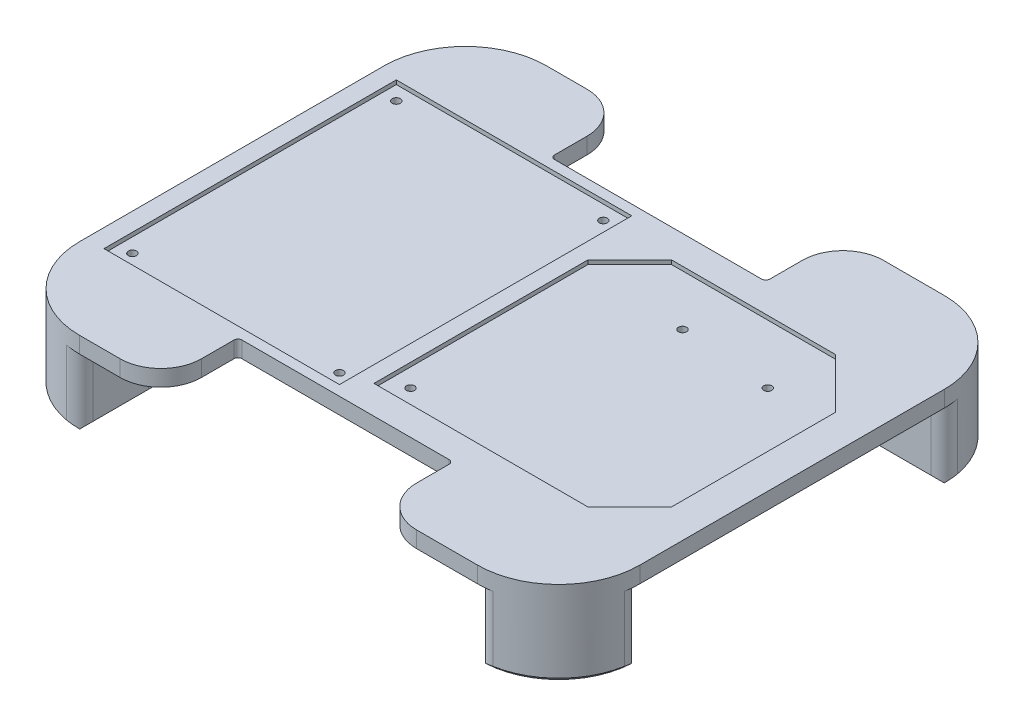
from build123d import *

# Parameters (mm, degrees)
TABLE_DEPTH                  = 4
PIEDS_START                  = 17
PIEDS_DEPTH                  = 17
ENL_V_MAT_EXTRU_3_DEPTH      = 93.240175629
ENL_V_MAT_EXTRU_3_DEPTH_BACK = 93.240175629
ESQUISSE5_W                  = 5
ESQUISSE5_H                  = 18
ENL_V_MAT_EXTRU_4_DEPTH      = 93.240175629
ENL_V_MAT_EXTRU_4_DEPTH_BACK = 93.240175629
ESQUISSE6_W                  = 43
ESQUISSE6_H                  = 18
CONG_1_R                     = 10
CHANFREIN1_SIZE              = 1
CONG_2_R                     = 3
ESQUISSE3_R                  = 1
ENL_V_MAT_EXTRU_5_DEPTH      = 18
ENL_V_MAT_EXTRU_6_DEPTH      = 93.240175629
ENL_V_MAT_EXTRU_6_DEPTH_BACK = 93.240175629
ESQUISSE4_R                  = 1
ESQUISSE8_W                  = 58
ESQUISSE8_H                  = 72
ENL_V_MAT_EXTRU_7_DEPTH      = 1
ENL_V_MAT_EXTRU_8_DEPTH      = 1
ENL_V_MAT_EXTRU_9_DEPTH      = 93.240175629
ENL_V_MAT_EXTRU_9_DEPTH_BACK = 93.240175629
ESQUISSE11_W                 = 53
ESQUISSE11_H                 = 1
CONG_3_R                     = 1
CONG_4_R                     = 3


with BuildPart() as part:
    # Esquisse1 → table (new body)
    with BuildSketch(Plane(origin=(0, 0, 0), x_dir=(1, 0, 0), z_dir=(0, 1, 0))):
        with BuildLine():
            Line((-49, -57.5), (49, -57.5))
            ThreePointArc((49, -57.5), (63.142135624, -51.642135624), (69, -37.5))
            Line((69, -37.5), (69, 37.5))
            ThreePointArc((69, 37.5), (63.142135624, 51.642135624), (49, 57.5))
            Line((49, 57.5), (-49, 57.5))
            ThreePointArc((-49, 57.5), (-63.142135624, 51.642135624), (-69, 37.5))
            Line((-69, 37.5), (-69, -37.5))
            ThreePointArc((-69, -37.5), (-63.142135624, -51.642135624), (-49, -57.5))
        make_face()
    extrude(amount=TABLE_DEPTH)

    # Esquisse2 → pieds (add)
    with BuildSketch(Plane.XZ.offset(PIEDS_START)):
        with BuildLine():
            Line((-49, 57.5), (-49, 37.5))
            Line((-49, 37.5), (-69, 37.5))
            ThreePointArc((-69, 37.5), (-63.142135624, 51.642135624), (-49, 57.5))
        make_face()
        with BuildLine():
            Line((-69, -37.5), (-49, -37.5))
            Line((-49, -37.5), (-49, -57.5))
            ThreePointArc((-49, -57.5), (-63.142135624, -51.642135624), (-69, -37.5))
        make_face()
        with BuildLine():
            Line((49, -57.5), (49, -37.5))
            Line((49, -37.5), (69, -37.5))
            ThreePointArc((69, -37.5), (63.142135624, -51.642135624), (49, -57.5))
        make_face()
        with BuildLine():
            Line((49, 57.5), (49, 37.5))
            Line((49, 37.5), (69, 37.5))
            ThreePointArc((69, 37.5), (63.142135624, 51.642135624), (49, 57.5))
        make_face()
    extrude(amount=-PIEDS_DEPTH)

    # Esquisse5 → Enlèv. mat.-Extru.3 (cut, two sides: drawn at the far end of the back side and taken through both)
    with BuildSketch(Plane(origin=(0, 4, 0), x_dir=(1, 0, 0), z_dir=(0, 1, 0)).offset(-ENL_V_MAT_EXTRU_3_DEPTH_BACK)):
        with Locations((-26.5, 48.5)):
            Rectangle(ESQUISSE5_W, ESQUISSE5_H)
        with Locations((21.5, 48.5)):
            Rectangle(ESQUISSE5_W, ESQUISSE5_H)
        with Locations((-26.5, -48.5)):
            Rectangle(ESQUISSE5_W, ESQUISSE5_H)
        with Locations((21.5, -48.5)):
            Rectangle(ESQUISSE5_W, ESQUISSE5_H)
    extrude(amount=ENL_V_MAT_EXTRU_3_DEPTH + ENL_V_MAT_EXTRU_3_DEPTH_BACK, mode=Mode.SUBTRACT)

    # Esquisse6 → Enlèv. mat.-Extru.4 (cut, two sides: drawn at the far end of the back side and taken through both)
    with BuildSketch(Plane(origin=(0, 4, 0), x_dir=(1, 0, 0), z_dir=(0, 1, 0)).offset(-ENL_V_MAT_EXTRU_4_DEPTH_BACK)):
        with Locations((-2.5, 48.5)):
            Rectangle(ESQUISSE6_W, ESQUISSE6_H)
        with Locations((-2.5, -48.5)):
            Rectangle(ESQUISSE6_W, ESQUISSE6_H)
    extrude(amount=ENL_V_MAT_EXTRU_4_DEPTH + ENL_V_MAT_EXTRU_4_DEPTH_BACK, mode=Mode.SUBTRACT)

    # Congé1
    cong_1_edges = [part.edges().sort_by_distance(p)[0] for p in [
        (24, 2, 57.5),
        (-29, 2, -57.5),
        (24, 2, -57.5),
        (-29, 2, 57.5),
    ]]
    fillet(cong_1_edges, radius=CONG_1_R)

    # Chanfrein1
    chanfrein1_edges = [part.edges().sort_by_distance(p)[0] for p in [
        (59, -17, -37.5),
        (49, -17, -47.5),
        (63.142135624, -17, -51.642135624),
        (-49, -17, -47.5),
        (-59, -17, -37.5),
        (-63.142135624, -17, -51.642135624),
        (-59, -17, 37.5),
        (-49, -17, 47.5),
        (-63.142135624, -17, 51.642135624),
        (59, -17, 37.5),
        (63.142135624, -17, 51.642135624),
        (49, -17, 47.5),
    ]]
    chamfer(chanfrein1_edges, length=CHANFREIN1_SIZE)

    # Congé2
    cong_2_edges = [part.edges().sort_by_distance(p)[0] for p in [
        (49, -8, 37.5),
        (49, -8, -37.5),
        (-49, -8, -37.5),
        (-49, -8, 37.5),
    ]]
    fillet(cong_2_edges, radius=CONG_2_R)

    # Esquisse3 → Enlèv. mat.-Extru.5 (cut)
    with BuildSketch(Plane(origin=(0, 4, 0), x_dir=(1, 0, 0), z_dir=(0, 1, 0))):
        with Locations(Location((-10, -32.5, 0), (0, 0, 270))):
            Circle(ESQUISSE3_R)
        with Locations(Location((-61, -32.5, 0), (0, 0, 270))):
            Circle(ESQUISSE3_R)
        with Locations(Location((-61, 32.5, 0), (0, 0, 270))):
            Circle(ESQUISSE3_R)
        with Locations(Location((-10, 32.5, 0), (0, 0, 270))):
            Circle(ESQUISSE3_R)
    extrude(amount=-ENL_V_MAT_EXTRU_5_DEPTH, mode=Mode.SUBTRACT)

    # Esquisse4 → Enlèv. mat.-Extru.6 (cut, two sides: drawn at the far end of the back side and taken through both)
    with BuildSketch(Plane(origin=(0, 4, 0), x_dir=(1, 0, 0), z_dir=(0, 1, 0)).offset(-ENL_V_MAT_EXTRU_6_DEPTH_BACK)):
        with Locations(Location((2, -27, 0), (0, 0, 270))):
            Circle(ESQUISSE4_R)
        with Locations(Location((46, 17, 0), (0, 0, 270))):
            Circle(ESQUISSE4_R)
        with Locations(Location((23, 19, 0), (0, 0, 270))):
            Circle(ESQUISSE4_R)
    extrude(amount=ENL_V_MAT_EXTRU_6_DEPTH + ENL_V_MAT_EXTRU_6_DEPTH_BACK, mode=Mode.SUBTRACT)

    # Esquisse8 → Enlèv. mat.-Extru.7 (cut)
    with BuildSketch(Plane(origin=(0, 4, 0), x_dir=(1, 0, 0), z_dir=(0, 1, 0))):
        with Locations((-35.5, 0)):
            Rectangle(ESQUISSE8_W, ESQUISSE8_H)
    extrude(amount=-ENL_V_MAT_EXTRU_7_DEPTH, mode=Mode.SUBTRACT)

    # Esquisse10 → Enlèv. mat.-Extru.8 (cut)
    with BuildSketch(Plane(origin=(0, 4, 0), x_dir=(1, 0, 0), z_dir=(0, 1, 0))):
        Polygon((-2.5, -31.5), (50.207106781, -31.5), (60.5, -21.207106781), (60.5, 19.207106781), (48.207106781, 31.5), (7.792893219, 31.5), (-2.5, 21.207106781), align=None)
    extrude(amount=-ENL_V_MAT_EXTRU_8_DEPTH, mode=Mode.SUBTRACT)

    # Esquisse11 → Enlèv. mat.-Extru.9 (cut, two sides: drawn at the far end of the back side and taken through both)
    with BuildSketch(Plane(origin=(0, 4, 0), x_dir=(1, 0, 0), z_dir=(0, 1, 0)).offset(-ENL_V_MAT_EXTRU_9_DEPTH_BACK)):
        with Locations((-2.5, 39)):
            Rectangle(ESQUISSE11_W, ESQUISSE11_H)
        with Locations((-2.5, -39)):
            Rectangle(ESQUISSE11_W, ESQUISSE11_H)
    extrude(amount=ENL_V_MAT_EXTRU_9_DEPTH + ENL_V_MAT_EXTRU_9_DEPTH_BACK, mode=Mode.SUBTRACT)

    # Congé3
    cong_3_edges = [part.edges().sort_by_distance(p)[0] for p in [
        (24, 2, -38.5),
        (-29, 2, -38.5),
        (-29, 2, 38.5),
        (24, 2, 38.5),
    ]]
    fillet(cong_3_edges, radius=CONG_3_R)

    # Congé4
    # the kernel refuses this fillet: 3 mm, written as the material it takes off along each edge
    with BuildSketch(Plane(origin=(69, -24.858353806, 37.5), x_dir=(-1, 0, 0), z_dir=(0, 1, 0)), Plane(origin=(-69, -24.858353806, -37.5), x_dir=(1, 0, 0), z_dir=(0, 1, 0)), Plane(origin=(49, -24.858353806, -57.5), x_dir=(0, 0, 1), z_dir=(0, 1, 0)), Plane(origin=(-49, -24.858353806, 57.5), x_dir=(0, 0, -1), z_dir=(0, 1, 0))) as cong_4_piece_1:
        with BuildLine():
            CenterArc((3.266799469, 3), CONG_4_R, 169.835751378, 100.164248622)
            ThreePointArc((0.313881729, 3.529411765), (0.078624979, 1.771670761), (0, 0))
            Line((0, 0), (3.266799469, 0))
        make_face()
    extrude(amount=24.858353806, mode=Mode.SUBTRACT)
    with BuildSketch(Plane(origin=(-49, -24.858353806, -57.5), x_dir=(0, 0, 1), z_dir=(0, 1, 0)), Plane(origin=(-69, -24.858353806, 37.5), x_dir=(1, 0, 0), z_dir=(0, 1, 0)), Plane(origin=(69, -24.858353806, -37.5), x_dir=(-1, 0, 0), z_dir=(0, 1, 0)), Plane(origin=(49, -24.858353806, 57.5), x_dir=(0, 0, -1), z_dir=(0, 1, 0))) as cong_4_piece_2:
        with BuildLine():
            CenterArc((3.266799469, -3), CONG_4_R, 90, 100.164248622)
            ThreePointArc((0.313881729, -3.529411765), (0.078624979, -1.771670761), (0, 0))
            Line((0, 0), (3.266799469, 0))
        make_face()
    extrude(amount=24.858353806, mode=Mode.SUBTRACT)


solid = part.part
